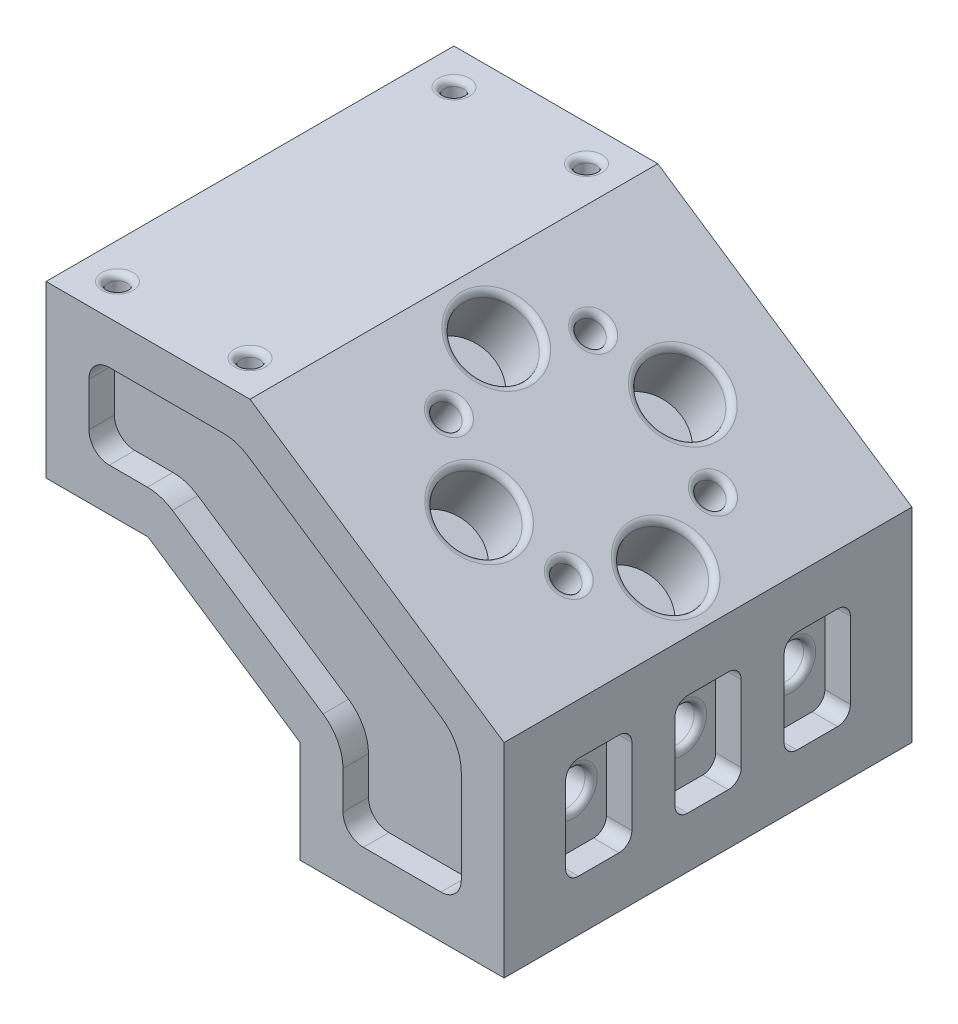
from build123d import *

# Parameters (mm, degrees)
BOSS_EXTRUDE1_DEPTH = 50.8
SKETCH2_R           = 4.445
SKETCH2_R_2         = 1.5875
CUT_EXTRUDE1_DEPTH  = 8.255
FILLET1_R           = 0.762
CUT_EXTRUDE4_DEPTH  = 3.175
CUT_EXTRUDE5_REACH  = 84.389
SKETCH4_R           = 2.2225
FILLET2_R           = 0.762
CUT_EXTRUDE6_REACH  = 81.708
SKETCH5_R           = 1.1811
FILLET3_R           = 0.762
CUT_EXTRUDE7_START  = 47.625
CUT_EXTRUDE7_DEPTH  = 3.175


# Read off the part's stored shape, not the designer's step: Cut-Extrude7
with BuildPart() as part:
    # Sketch1 → Boss-Extrude1 (new body)
    with BuildSketch(Plane.XY):
        Polygon((-17.04335092, 14.914716129), (-4.34335092, 14.914716129), (14.60504908, 2.214192509), (14.60504908, -10.485283871), (40.00504908, -10.485283871), (40.00504908, 14.910777213), (8.35664908, 36.123716129), (-17.04335092, 36.123716129), align=None)
    extrude(amount=BOSS_EXTRUDE1_DEPTH)

    # Sketch2 → Cut-Extrude1 (cut)
    with BuildSketch(Plane(origin=(19.297370886, 28.790490331, 0), x_dir=(0.8306666666666668, -0.5567700502800853, 0), z_dir=(0.5567700502800853, 0.8306666666666668, 0))):
        with Locations(Location((5.878986591, -12.707773671, 0), (0, 0, 180))):
            Circle(SKETCH2_R)
        with Locations(Location((5.878986591, -38.092226329, 0), (0, 0, 180))):
            Circle(SKETCH2_R)
        with Locations(Location((-6.823508152, -25.4, 0), (0, 0, 180))):
            Circle(SKETCH2_R)
        with Locations(Location((18.581481333, -25.4, 0), (0, 0, 180))):
            Circle(SKETCH2_R)
        with Locations(Location((-3.10303358, -34.38202017, 0), (0, 0, 180))):
            Circle(SKETCH2_R_2)
        with Locations((14.861006761, -34.38202017)):
            Circle(SKETCH2_R_2)
        with Locations((-3.10303358, -16.41797983)):
            Circle(SKETCH2_R_2)
        with Locations(Location((14.861006761, -16.41797983, 0), (0, 0, 180))):
            Circle(SKETCH2_R_2)
    extrude(amount=-CUT_EXTRUDE1_DEPTH, mode=Mode.SUBTRACT)

    # Fillet1
    fillet1_edges = [part.edges().sort_by_distance(p)[0] for p in [
        (18.038467659, 29.634294038, 34.38202017),
        (38.42470138, 15.970035161, 25.4),
        (17.321623448, 30.114772434, 25.4),
        (27.873162414, 23.042403798, 38.092226329),
        (32.960597168, 19.632454395, 16.41797983),
        (15.401100992, 31.402038948, 16.41797983),
        (30.323230502, 21.400199304, 34.38202017),
        (27.873162414, 23.042403798, 12.707773671),
    ]]
    fillet(fillet1_edges, radius=FILLET1_R)

    # Sketch3 → Cut-Extrude4 (cut)
    with BuildSketch(Plane(origin=(40.00504908, 0, 0), x_dir=(0, 0, -1), z_dir=(1, 0, 0))):
        with BuildLine():
            Line((-43.136139989, 6.964516129), (-43.136139989, -2.535083871))
            ThreePointArc((-43.136139989, -2.535083871), (-42.66745226, -3.666596142), (-41.535939989, -4.135283871))
            Line((-41.535939989, -4.135283871), (-36.481339989, -4.135283871))
            ThreePointArc((-36.481339989, -4.135283871), (-35.349827718, -3.666596142), (-34.881139989, -2.535083871))
            Line((-34.881139989, -2.535083871), (-34.881139989, 6.964516129))
            ThreePointArc((-34.881139989, 6.964516129), (-35.349827718, 8.0960284), (-36.481339989, 8.564716129))
            Line((-36.481339989, 8.564716129), (-41.535939989, 8.564716129))
            ThreePointArc((-41.535939989, 8.564716129), (-42.66745226, 8.0960284), (-43.136139989, 6.964516129))
        make_face()
        with BuildLine():
            Line((-27.9273, 8.564716129), (-22.8727, 8.564716129))
            ThreePointArc((-22.8727, 8.564716129), (-21.741187729, 8.0960284), (-21.2725, 6.964516129))
            Line((-21.2725, 6.964516129), (-21.2725, -2.535083871))
            ThreePointArc((-21.2725, -2.535083871), (-21.741187729, -3.666596142), (-22.8727, -4.135283871))
            Line((-22.8727, -4.135283871), (-27.9273, -4.135283871))
            ThreePointArc((-27.9273, -4.135283871), (-29.058812271, -3.666596142), (-29.5275, -2.535083871))
            Line((-29.5275, -2.535083871), (-29.5275, 6.964516129))
            ThreePointArc((-29.5275, 6.964516129), (-29.058812271, 8.0960284), (-27.9273, 8.564716129))
        make_face()
        with BuildLine():
            Line((-14.318660011, 8.564716129), (-9.264060011, 8.564716129))
            ThreePointArc((-9.264060011, 8.564716129), (-8.13254774, 8.0960284), (-7.663860011, 6.964516129))
            Line((-7.663860011, 6.964516129), (-7.663860011, -2.535083871))
            ThreePointArc((-7.663860011, -2.535083871), (-8.13254774, -3.666596142), (-9.264060011, -4.135283871))
            Line((-9.264060011, -4.135283871), (-14.318660011, -4.135283871))
            ThreePointArc((-14.318660011, -4.135283871), (-15.450172282, -3.666596142), (-15.918860011, -2.535083871))
            Line((-15.918860011, -2.535083871), (-15.918860011, 6.964516129))
            ThreePointArc((-15.918860011, 6.964516129), (-15.450172282, 8.0960284), (-14.318660011, 8.564716129))
        make_face()
    extrude(amount=-CUT_EXTRUDE4_DEPTH, mode=Mode.SUBTRACT)

    # Sketch4 → Cut-Extrude5 (cut, up to next)
    with BuildSketch(Plane(origin=(36.83004908, 0, 0), x_dir=(0, 0, -1), z_dir=(1, 0, 0)), mode=Mode.PRIVATE) as cut_extrude5_sk1:
        with Locations((-39.008639989, 2.214716129)):
            Circle(SKETCH4_R)
    cut_extrude5_tool1 = extrude(cut_extrude5_sk1.sketch, amount=-CUT_EXTRUDE5_REACH, mode=Mode.PRIVATE) & part.part
    # Sketch4 → Cut-Extrude5 (cut, up to next)
    with BuildSketch(Plane(origin=(36.83004908, 0, 0), x_dir=(0, 0, -1), z_dir=(1, 0, 0)), mode=Mode.PRIVATE) as cut_extrude5_sk2:
        with Locations((-25.4, 2.214716129)):
            Circle(SKETCH4_R)
    cut_extrude5_tool2 = extrude(cut_extrude5_sk2.sketch, amount=-CUT_EXTRUDE5_REACH, mode=Mode.PRIVATE) & part.part
    # Sketch4 → Cut-Extrude5 (cut, up to next)
    with BuildSketch(Plane(origin=(36.83004908, 0, 0), x_dir=(0, 0, -1), z_dir=(1, 0, 0)), mode=Mode.PRIVATE) as cut_extrude5_sk3:
        with Locations((-11.791360011, 2.214716129)):
            Circle(SKETCH4_R)
    cut_extrude5_tool3 = extrude(cut_extrude5_sk3.sketch, amount=-CUT_EXTRUDE5_REACH, mode=Mode.PRIVATE) & part.part
    add(cut_extrude5_tool1.solids().sort_by_distance((36.830049, 2.214716, 39.00864))[0], mode=Mode.SUBTRACT)
    add(cut_extrude5_tool2.solids().sort_by_distance((36.830049, 2.214716, 25.4))[0], mode=Mode.SUBTRACT)
    add(cut_extrude5_tool3.solids().sort_by_distance((36.830049, 2.214716, 11.79136))[0], mode=Mode.SUBTRACT)

    # Fillet2
    fillet2_edges = [part.edges().sort_by_distance(p)[0] for p in [
        (36.83004908, 2.214716129, 41.231139989),
        (36.83004908, 2.214716129, 27.6225),
        (36.83004908, 2.214716129, 14.013860011),
    ]]
    fillet(fillet2_edges, radius=FILLET2_R)

    # Sketch5 → Cut-Extrude6 (cut, up to next)
    with BuildSketch(Plane(origin=(0, 36.123716129, 0), x_dir=(1, 0, 0), z_dir=(0, 1, 0)), mode=Mode.PRIVATE) as cut_extrude6_sk1:
        with Locations(Location((-12.59835092, -4.445, 0), (0, 0, 270))):
            Circle(SKETCH5_R)
    cut_extrude6_tool1 = extrude(cut_extrude6_sk1.sketch, amount=-CUT_EXTRUDE6_REACH, mode=Mode.PRIVATE) & part.part
    # Sketch5 → Cut-Extrude6 (cut, up to next)
    with BuildSketch(Plane(origin=(0, 36.123716129, 0), x_dir=(1, 0, 0), z_dir=(0, 1, 0)), mode=Mode.PRIVATE) as cut_extrude6_sk2:
        with Locations(Location((3.91164908, -4.445, 0), (0, 0, 180))):
            Circle(SKETCH5_R)
    cut_extrude6_tool2 = extrude(cut_extrude6_sk2.sketch, amount=-CUT_EXTRUDE6_REACH, mode=Mode.PRIVATE) & part.part
    # Sketch5 → Cut-Extrude6 (cut, up to next)
    with BuildSketch(Plane(origin=(0, 36.123716129, 0), x_dir=(1, 0, 0), z_dir=(0, 1, 0)), mode=Mode.PRIVATE) as cut_extrude6_sk3:
        with Locations(Location((-12.59835092, -46.355, 0), (0, 0, 180))):
            Circle(SKETCH5_R)
    cut_extrude6_tool3 = extrude(cut_extrude6_sk3.sketch, amount=-CUT_EXTRUDE6_REACH, mode=Mode.PRIVATE) & part.part
    # Sketch5 → Cut-Extrude6 (cut, up to next)
    with BuildSketch(Plane(origin=(0, 36.123716129, 0), x_dir=(1, 0, 0), z_dir=(0, 1, 0)), mode=Mode.PRIVATE) as cut_extrude6_sk4:
        with Locations(Location((3.91164908, -46.355, 0), (0, 0, 270))):
            Circle(SKETCH5_R)
    cut_extrude6_tool4 = extrude(cut_extrude6_sk4.sketch, amount=-CUT_EXTRUDE6_REACH, mode=Mode.PRIVATE) & part.part
    add(cut_extrude6_tool1.solids().sort_by_distance((-12.598351, 36.123716, 4.445))[0], mode=Mode.SUBTRACT)
    add(cut_extrude6_tool2.solids().sort_by_distance((3.911649, 36.123716, 4.445))[0], mode=Mode.SUBTRACT)
    add(cut_extrude6_tool3.solids().sort_by_distance((-12.598351, 36.123716, 46.355))[0], mode=Mode.SUBTRACT)
    add(cut_extrude6_tool4.solids().sort_by_distance((3.911649, 36.123716, 46.355))[0], mode=Mode.SUBTRACT)

    # Fillet3
    fillet3_edges = [part.edges().sort_by_distance(p)[0] for p in [
        (5.09274908, 36.123716129, 4.445),
        (-11.41725092, 36.123716129, 46.355),
        (3.91164908, 36.123716129, 45.1739),
        (-12.59835092, 36.123716129, 3.2639),
    ]]
    fillet(fillet3_edges, radius=FILLET3_R)

    # Cut-Extrude7 outline → Cut-Extrude7 (cut)
    with BuildSketch(Plane.XY.offset(CUT_EXTRUDE7_START)):
        with BuildLine():
            Line((22.47904908, -5.151283871), (32.13104908, -5.151283871))
            ThreePointArc((32.13104908, -5.151283871), (33.927100305, -4.407335096), (34.67104908, -2.611283871))
            Line((34.67104908, -2.611283871), (34.67104908, 9.080738404))
            ThreePointArc((34.67104908, 9.080738404), (34.0131253, 11.711345268), (32.194280121, 13.722503737))
            Line((32.194280121, 13.722503737), (8.142772998, 29.843481462))
            ThreePointArc((8.142772998, 29.843481462), (6.657512331, 30.547926407), (5.031541957, 30.789716129))
            Line((5.031541957, 30.789716129), (-9.16935092, 30.789716129))
            ThreePointArc((-9.16935092, 30.789716129), (-10.965402144, 30.045767353), (-11.70935092, 28.249716129))
            Line((-11.70935092, 28.249716129), (-11.70935092, 22.788716129))
            ThreePointArc((-11.70935092, 22.788716129), (-10.965402144, 20.992664905), (-9.16935092, 20.248716129))
            Line((-9.16935092, 20.248716129), (-4.417258043, 20.248716129))
            ThreePointArc((-4.417258043, 20.248716129), (-2.791287669, 20.006926407), (-1.306027002, 19.302481462))
            Line((-1.306027002, 19.302481462), (17.462280121, 6.7226685))
            ThreePointArc((17.462280121, 6.7226685), (19.2811253, 4.71151003), (19.93904908, 2.080903166))
            Line((19.93904908, 2.080903166), (19.93904908, -2.611283871))
            ThreePointArc((19.93904908, -2.611283871), (20.682997856, -4.407335095), (22.47904908, -5.151283871))
        make_face()
    extrude(amount=CUT_EXTRUDE7_DEPTH, mode=Mode.SUBTRACT)


solid = part.part
